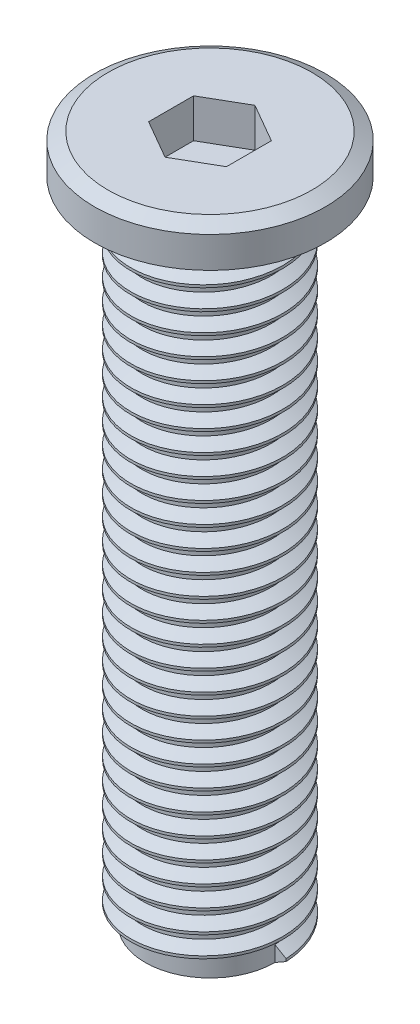
from build123d import *
from build123d.topology import SkipClean

# Parameters (mm, degrees)
SKETCH1_R           = 4.45
BOSS_EXTRUDE1_DEPTH = 1.5
CHAMFER2_SIZE       = 0.3
CHAMFER2_SIZE2      = 0.519615242
CUT_EXTRUDE1_DEPTH  = 3
SKETCH3_R           = 2.5
BOSS_EXTRUDE2_DEPTH = 25
THREAD1_PITCH       = 0.8


with BuildPart() as part:
    # Sketch1 → Boss-Extrude1 (new body)
    with BuildSketch(Plane(origin=(0, 0, 0), x_dir=(1, 0, 0), z_dir=(0, 1, 0))):
        with Locations(Location((0, 0, 0), (0, 0, 270))):
            Circle(SKETCH1_R)
    extrude(amount=BOSS_EXTRUDE1_DEPTH)

    # Chamfer2
    chamfer2_edges = [part.edges().sort_by_distance(p)[0] for p in [
        (0, 1.5, -4.45),
    ]]
    chamfer2_side = [part.faces().sort_by_distance(p)[0] for p in [
        (0, 0.75, -4.45),
    ]]
    chamfer(chamfer2_edges, length=CHAMFER2_SIZE, length2=CHAMFER2_SIZE2, reference=chamfer2_side[0])

    # Sketch8 → Cut-Extrude1 (cut)
    with BuildSketch(Plane(origin=(0, 1.5, 0), x_dir=(1, 0, 0), z_dir=(0, 1, 0))):
        Polygon((0, 1.732050808), (-1.5, 0.866025404), (-1.5, -0.866025404), (0, -1.732050808), (1.5, -0.866025404), (1.5, 0.866025404), align=None)
    extrude(amount=-CUT_EXTRUDE1_DEPTH, mode=Mode.SUBTRACT)

    # Sketch3 → Boss-Extrude2 (add)
    with BuildSketch(Plane.XZ):
        with Locations(Location((0, 0, 0), (0, 0, 90))):
            Circle(SKETCH3_R)
    extrude(amount=BOSS_EXTRUDE2_DEPTH)

    # Thread1: the profile of Thread Profile2 profile screwed along a right-hand helix of 30.5 turns, 8 arcs to a turn; built about Z, then put on its axis
    with SkipClean():  # the faces are left unmerged after this step: merging them gives an invalid solid
        thread1_z = Axis((0, 0, 0), (0, 0, 1))
        thread1_corners = [(2.4997, 0, -0.000173205), (2.9330127, 0, 0.249999999), (2.9330127, 0, 0.349999999), (2.4997, 0, 0.600173203)]
        with BuildLine(mode=Mode.PRIVATE) as thread1_profile:
            Line(thread1_corners[0], thread1_corners[1])
            Line(thread1_corners[1], thread1_corners[2])
            Line(thread1_corners[2], thread1_corners[3])
            Line(thread1_corners[3], thread1_corners[0])
        thread1_cap = Face(thread1_profile.wire())
        thread1_turn_angles = [0, 22.5, 45, 67.5, 90, 112.5, 135, 157.5, 180, 202.5, 225, 247.5, 270, 292.5, 315, 337.5, 360]
        thread1_turn_weights = [1, 0.9238795325112867, 1, 0.9238795325112867, 1, 0.9238795325112867, 1, 0.9238795325112867, 1, 0.9238795325112867, 1, 0.9238795325112867, 1, 0.9238795325112867, 1, 0.9238795325112867, 1]
        thread1_turn_rails = [Edge.make_bspline([Vector(p[0], p[1], 0).rotate(thread1_z, thread1_turn_angles[k]) / thread1_turn_weights[k] + Vector(0, 0, p[2] + THREAD1_PITCH * thread1_turn_angles[k] / 360) for k in range(17)], [0, 0, 0, 1, 1, 2, 2, 3, 3, 4, 4, 5, 5, 6, 6, 7, 7, 8, 8, 8], 2, thread1_turn_weights) for p in thread1_corners]
        thread1_turn_sides = [Face.make_surface_from_curves(thread1_turn_rails[p[0]], thread1_turn_rails[p[1]]) for p in [(0, 1), (1, 2), (2, 3), (3, 0)]]
        thread1_last_angles = [10800, 10822.5, 10845, 10867.5, 10890, 10912.5, 10935, 10957.5, 10980]
        thread1_last_weights = [1, 0.9238795325112867, 1, 0.9238795325112867, 1, 0.9238795325112867, 1, 0.9238795325112867, 1]
        thread1_last_rails = [Edge.make_bspline([Vector(p[0], p[1], 0).rotate(thread1_z, thread1_last_angles[k]) / thread1_last_weights[k] + Vector(0, 0, p[2] + THREAD1_PITCH * thread1_last_angles[k] / 360) for k in range(9)], [0, 0, 0, 1, 1, 2, 2, 3, 3, 4, 4, 4], 2, thread1_last_weights) for p in thread1_corners]
        thread1_last_sides = [Face.make_surface_from_curves(thread1_last_rails[p[0]], thread1_last_rails[p[1]]) for p in [(0, 1), (1, 2), (2, 3), (3, 0)]]
        thread1 = Plane(origin=(0, 0, 0), x_dir=(-1, 0, 0), z_dir=(0, -1, 0)) * Solid(Shell([*[p.moved(Location((0, 0, THREAD1_PITCH * i))) for i in range(30) for p in thread1_turn_sides], *thread1_last_sides, thread1_cap, thread1_cap.rotate(thread1_z, 10980).moved(Location((0, 0, THREAD1_PITCH * 10980 / 360)))]))
        add(thread1)


solid = part.part
